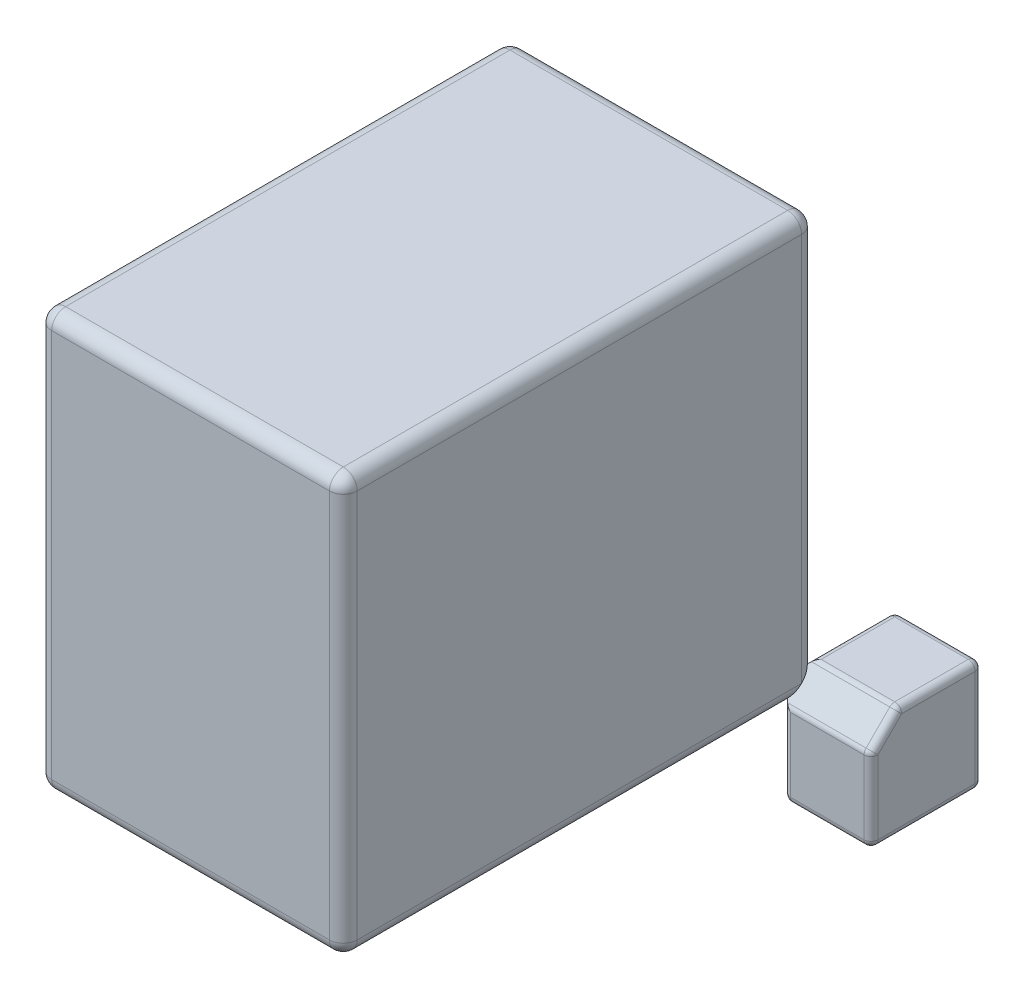
from build123d import *

# Parameters (mm, degrees)
SKETCH1_W                = 22
SKETCH1_H                = 30
BOSS_EXTRUDE1_DEPTH      = 34
SHELL1_T                 = 1
BOSS_EXTRUDE3_DEPTH      = 6
BOSS_EXTRUDE3_DEPTH_BACK = 2
SKETCH2_W                = 8
SKETCH2_H                = 8
CHAMFER2_SIZE            = 2
FILLET1_R                = 1
FILLET2_R                = 0.5


with BuildPart() as part:
    # Sketch1 → Boss-Extrude1 (new body)
    with BuildSketch(Plane.XY):
        with Locations((11, 15)):
            Rectangle(SKETCH1_W, SKETCH1_H)
    extrude(amount=BOSS_EXTRUDE1_DEPTH)

    # Shell1 (no face opened: a closed hollow body)
    add(offset(amount=-SHELL1_T, mode=Mode.PRIVATE), mode=Mode.SUBTRACT)

    # Sketch2 → Boss-Extrude3 (add, two sides: drawn at the far end of the back side and taken through both)
    with BuildSketch(Plane(origin=(0, 0, 0), x_dir=(-1, 0, 0), z_dir=(0, 0, -1)).offset(-BOSS_EXTRUDE3_DEPTH_BACK)):
        with Locations((-24, -2)):
            Rectangle(SKETCH2_W, SKETCH2_H)
    extrude(amount=BOSS_EXTRUDE3_DEPTH + BOSS_EXTRUDE3_DEPTH_BACK)

    # Chamfer2
    chamfer2_edges = [part.edges().sort_by_distance(p)[0] for p in [
        (20, -3, 2),
        (20, 2, -3),
        (25, 2, 2),
    ]]
    chamfer(chamfer2_edges, length=CHAMFER2_SIZE)

    # Fillet1
    # the kernel refuses this fillet: 1 mm, written as the material it takes off along each edge
    with BuildSketch(Plane(origin=(1, 29, 1), x_dir=(0, 1, 0), z_dir=(0, 0, -1))) as fillet1_piece_1_section:
        Polygon((0, 0), (FILLET1_R, 0), (FILLET1_R, -FILLET1_R), (0, -FILLET1_R), align=None)
    fillet1_piece_1 = extrude(amount=FILLET1_R, mode=Mode.PRIVATE)
    fillet1_piece_1 = fillet1_piece_1 - Plane(origin=(1, 29, 1), x_dir=(0.7071067811865475, -0.7071067811865475, 0), z_dir=(0, 0, -1)) * Sphere(FILLET1_R, mode=Mode.PRIVATE)
    add(fillet1_piece_1, mode=Mode.SUBTRACT)
    with BuildSketch(Plane(origin=(1, 1, 1), x_dir=(0, 0, -1), z_dir=(0, -1, 0))) as fillet1_piece_2_section:
        Polygon((0, 0), (FILLET1_R, 0), (FILLET1_R, -FILLET1_R), (0, -FILLET1_R), align=None)
    fillet1_piece_2 = extrude(amount=FILLET1_R, mode=Mode.PRIVATE)
    fillet1_piece_2 = fillet1_piece_2 - Plane(origin=(1, 1, 1), x_dir=(0.7071067811865475, 0, 0.7071067811865475), z_dir=(0, -1, 0)) * Sphere(FILLET1_R, mode=Mode.PRIVATE)
    add(fillet1_piece_2, mode=Mode.SUBTRACT)
    with BuildSketch(Plane(origin=(21, 29, 1), x_dir=(0, 0, -1), z_dir=(0, 1, 0))) as fillet1_piece_3_section:
        Polygon((0, 0), (FILLET1_R, 0), (FILLET1_R, -FILLET1_R), (0, -FILLET1_R), align=None)
    fillet1_piece_3 = extrude(amount=FILLET1_R, mode=Mode.PRIVATE)
    fillet1_piece_3 = fillet1_piece_3 - Plane(origin=(21, 29, 1), x_dir=(-0.7071067811865475, 0, 0.7071067811865475), z_dir=(0, 1, 0)) * Sphere(FILLET1_R, mode=Mode.PRIVATE)
    add(fillet1_piece_3, mode=Mode.SUBTRACT)
    with BuildSketch(Plane(origin=(1, 1, 33), x_dir=(-1, 0, 0), z_dir=(0, -1, 0))) as fillet1_piece_4_section:
        Polygon((0, 0), (FILLET1_R, 0), (FILLET1_R, -FILLET1_R), (0, -FILLET1_R), align=None)
    fillet1_piece_4 = extrude(amount=FILLET1_R, mode=Mode.PRIVATE)
    fillet1_piece_4 = fillet1_piece_4 - Plane(origin=(1, 1, 33), x_dir=(0.7071067811865475, 0, -0.7071067811865475), z_dir=(0, -1, 0)) * Sphere(FILLET1_R, mode=Mode.PRIVATE)
    add(fillet1_piece_4, mode=Mode.SUBTRACT)
    with BuildSketch(Plane(origin=(21, 1, 33), x_dir=(1, 0, 0), z_dir=(0, -1, 0))) as fillet1_piece_5_section:
        Polygon((0, 0), (FILLET1_R, 0), (FILLET1_R, FILLET1_R), (0, FILLET1_R), align=None)
    fillet1_piece_5 = extrude(amount=FILLET1_R, mode=Mode.PRIVATE)
    fillet1_piece_5 = fillet1_piece_5 - Plane(origin=(21, 1, 33), x_dir=(-0.7071067811865475, 0, -0.7071067811865475), z_dir=(0, -1, 0)) * Sphere(FILLET1_R, mode=Mode.PRIVATE)
    add(fillet1_piece_5, mode=Mode.SUBTRACT)
    with BuildSketch(Plane(origin=(21, 29, 33), x_dir=(1, 0, 0), z_dir=(0, 1, 0))) as fillet1_piece_6_section:
        Polygon((0, 0), (FILLET1_R, 0), (FILLET1_R, -FILLET1_R), (0, -FILLET1_R), align=None)
    fillet1_piece_6 = extrude(amount=FILLET1_R, mode=Mode.PRIVATE)
    fillet1_piece_6 = fillet1_piece_6 - Plane(origin=(21, 29, 33), x_dir=(-0.7071067811865475, 0, -0.7071067811865475), z_dir=(0, 1, 0)) * Sphere(FILLET1_R, mode=Mode.PRIVATE)
    add(fillet1_piece_6, mode=Mode.SUBTRACT)
    with BuildSketch(Plane(origin=(1, 29, 33), x_dir=(-1, 0, 0), z_dir=(0, 1, 0))) as fillet1_piece_7_section:
        Polygon((0, 0), (FILLET1_R, 0), (FILLET1_R, FILLET1_R), (0, FILLET1_R), align=None)
    fillet1_piece_7 = extrude(amount=FILLET1_R, mode=Mode.PRIVATE)
    fillet1_piece_7 = fillet1_piece_7 - Plane(origin=(1, 29, 33), x_dir=(0.7071067811865475, 0, -0.7071067811865475), z_dir=(0, 1, 0)) * Sphere(FILLET1_R, mode=Mode.PRIVATE)
    add(fillet1_piece_7, mode=Mode.SUBTRACT)
    with BuildSketch(Plane(origin=(0, 29, 0), x_dir=(1, 0, 0), z_dir=(0, -1, 0)), Plane(origin=(22, 1, 34), x_dir=(0, 0, -1), z_dir=(0, 1, 0)), Plane(origin=(0, 29, 34), x_dir=(0, 0, -1), z_dir=(0, -1, 0))) as fillet1_piece_8:
        with BuildLine():
            CenterArc((FILLET1_R, FILLET1_R), FILLET1_R, 180, 90)
            Line((0, FILLET1_R), (0, 0))
            Line((0, 0), (FILLET1_R, 0))
        make_face()
    extrude(amount=28, mode=Mode.SUBTRACT)
    with BuildSketch(Plane(origin=(1, 0, 0), x_dir=(0, 0, 1), z_dir=(1, 0, 0))) as fillet1_piece_9_section:
        with BuildLine():
            CenterArc((FILLET1_R, -FILLET1_R), FILLET1_R, 90, 90)
            Line((0, -FILLET1_R), (0, 0))
            Line((0, 0), (FILLET1_R, 0))
        make_face()
    fillet1_piece_9 = extrude(amount=21.5, mode=Mode.PRIVATE)
    fillet1_piece_9 = split(fillet1_piece_9, bisect_by=Plane(origin=(15.381840504, 0.226418621, -4.618159496), z_dir=(-0.7071067811865476, 0, 0.7071067811865476)), keep=Keep.TOP, mode=Mode.PRIVATE)
    fillet1_piece_9 = split(fillet1_piece_9, bisect_by=Plane(origin=(15.381840504, -4.618159496, 0.226418621), z_dir=(-0.7071067811865475, 0.7071067811865476, 0)), keep=Keep.TOP, mode=Mode.PRIVATE)
    add(fillet1_piece_9, mode=Mode.SUBTRACT)
    with BuildSketch(Plane(origin=(1, 0, 0), x_dir=(0, 0, 1), z_dir=(1, 0, 0))) as fillet1_piece_10_section:
        with BuildLine():
            CenterArc((FILLET1_R, -FILLET1_R), FILLET1_R, 90, 90)
            Line((0, -FILLET1_R), (0, 0))
            Line((0, 0), (FILLET1_R, 0))
        make_face()
    fillet1_piece_10 = extrude(amount=21.5, mode=Mode.PRIVATE)
    fillet1_piece_10 = split(fillet1_piece_10, bisect_by=Plane(origin=(20.16446835, 0.528927527, 0.16446835), z_dir=(0.7071067811865476, 0, -0.7071067811865476)), keep=Keep.TOP, mode=Mode.PRIVATE)
    fillet1_piece_10 = split(fillet1_piece_10, bisect_by=Plane(origin=(20.407441135, 0.407441135, 0.042981958), z_dir=(-0.7071067811865475, 0.7071067811865476, 0)), keep=Keep.TOP, mode=Mode.PRIVATE)
    add(fillet1_piece_10, mode=Mode.SUBTRACT)
    with BuildSketch(Plane(origin=(1, 0, 0), x_dir=(0, 0, 1), z_dir=(1, 0, 0))) as fillet1_piece_11_section:
        with BuildLine():
            CenterArc((FILLET1_R, -FILLET1_R), FILLET1_R, 90, 90)
            Line((0, -FILLET1_R), (0, 0))
            Line((0, 0), (FILLET1_R, 0))
        make_face()
    fillet1_piece_11 = extrude(amount=21.5, mode=Mode.PRIVATE)
    fillet1_piece_11 = split(fillet1_piece_11, bisect_by=Plane(origin=(20.407441135, 0.042981958, 0.407441135), z_dir=(-0.7071067811865476, 0, 0.7071067811865476)), keep=Keep.TOP, mode=Mode.PRIVATE)
    fillet1_piece_11 = split(fillet1_piece_11, bisect_by=Plane(origin=(20.16446835, 0.16446835, 0.528927527), z_dir=(0.7071067811865475, -0.7071067811865476, 0)), keep=Keep.TOP, mode=Mode.PRIVATE)
    add(fillet1_piece_11, mode=Mode.SUBTRACT)
    with BuildSketch(Plane(origin=(22, -0.5, 0), x_dir=(-1, 0, 0), z_dir=(0, 1, 0))) as fillet1_piece_12_section:
        with BuildLine():
            CenterArc((FILLET1_R, FILLET1_R), FILLET1_R, 180, 90)
            Line((0, FILLET1_R), (0, 0))
            Line((0, 0), (FILLET1_R, 0))
        make_face()
    fillet1_piece_12 = extrude(amount=29.5, mode=Mode.PRIVATE)
    fillet1_piece_12 = split(fillet1_piece_12, bisect_by=Plane(origin=(21.83553165, 1.83553165, 0.528927527), z_dir=(0.7071067811865475, -0.7071067811865476, 0)), keep=Keep.TOP, mode=Mode.PRIVATE)
    fillet1_piece_12 = split(fillet1_piece_12, bisect_by=Plane(origin=(21.957018042, 1.592558865, 0.407441135), z_dir=(0, 0.7071067811865476, 0.7071067811865476)), keep=Keep.TOP, mode=Mode.PRIVATE)
    add(fillet1_piece_12, mode=Mode.SUBTRACT)
    with BuildSketch(Plane(origin=(22, -0.5, 0), x_dir=(-1, 0, 0), z_dir=(0, 1, 0))) as fillet1_piece_13_section:
        with BuildLine():
            CenterArc((FILLET1_R, FILLET1_R), FILLET1_R, 180, 90)
            Line((0, FILLET1_R), (0, 0))
            Line((0, 0), (FILLET1_R, 0))
        make_face()
    fillet1_piece_13 = extrude(amount=29.5, mode=Mode.PRIVATE)
    fillet1_piece_13 = split(fillet1_piece_13, bisect_by=Plane(origin=(21.592558865, 1.592558865, 0.042981958), z_dir=(-0.7071067811865475, 0.7071067811865476, 0)), keep=Keep.TOP, mode=Mode.PRIVATE)
    fillet1_piece_13 = split(fillet1_piece_13, bisect_by=Plane(origin=(21.471072473, 1.83553165, 0.16446835), z_dir=(0, -0.7071067811865476, -0.7071067811865476)), keep=Keep.TOP, mode=Mode.PRIVATE)
    add(fillet1_piece_13, mode=Mode.SUBTRACT)
    with BuildSketch(Plane(origin=(22, -0.5, 0), x_dir=(-1, 0, 0), z_dir=(0, 1, 0))) as fillet1_piece_14_section:
        with BuildLine():
            CenterArc((FILLET1_R, FILLET1_R), FILLET1_R, 180, 90)
            Line((0, FILLET1_R), (0, 0))
            Line((0, 0), (FILLET1_R, 0))
        make_face()
    fillet1_piece_14 = extrude(amount=29.5, mode=Mode.PRIVATE)
    fillet1_piece_14 = split(fillet1_piece_14, bisect_by=Plane(origin=(28.618183131, 8.618183131, 0.226411675), z_dir=(-0.7071067811865475, 0.7071067811865476, 0)), keep=Keep.TOP, mode=Mode.PRIVATE)
    fillet1_piece_14 = split(fillet1_piece_14, bisect_by=Plane(origin=(21.773588325, 8.618183131, -6.618183131), z_dir=(0, 0.7071067811865476, 0.7071067811865476)), keep=Keep.TOP, mode=Mode.PRIVATE)
    add(fillet1_piece_14, mode=Mode.SUBTRACT)
    with BuildSketch(Plane(origin=(21, 30, 0), x_dir=(0, -1, 0), z_dir=(-1, 0, 0)), Plane(origin=(1, 0, 34), x_dir=(0, 0, -1), z_dir=(1, 0, 0))) as fillet1_piece_15:
        with BuildLine():
            CenterArc((FILLET1_R, FILLET1_R), FILLET1_R, 180, 90)
            Line((0, FILLET1_R), (0, 0))
            Line((0, 0), (FILLET1_R, 0))
        make_face()
    extrude(amount=20, mode=Mode.SUBTRACT)
    with BuildSketch(Plane(origin=(21, 30, 34), x_dir=(0, -1, 0), z_dir=(-1, 0, 0))) as fillet1_piece_16:
        with BuildLine():
            CenterArc((FILLET1_R, -FILLET1_R), FILLET1_R, 90, 90)
            Line((0, -FILLET1_R), (0, 0))
            Line((0, 0), (FILLET1_R, 0))
        make_face()
    extrude(amount=20, mode=Mode.SUBTRACT)
    with BuildSketch(Plane(origin=(0, 30, 1), x_dir=(0, -1, 0), z_dir=(0, 0, 1)), Plane(origin=(0, 0, 1), x_dir=(1, 0, 0), z_dir=(0, 0, 1))) as fillet1_piece_17:
        with BuildLine():
            CenterArc((FILLET1_R, FILLET1_R), FILLET1_R, 180, 90)
            Line((0, FILLET1_R), (0, 0))
            Line((0, 0), (FILLET1_R, 0))
        make_face()
    extrude(amount=32, mode=Mode.SUBTRACT)
    with BuildSketch(Plane(origin=(22, 30, 1), x_dir=(0, -1, 0), z_dir=(0, 0, 1))) as fillet1_piece_18:
        with BuildLine():
            CenterArc((FILLET1_R, -FILLET1_R), FILLET1_R, 90, 90)
            Line((0, -FILLET1_R), (0, 0))
            Line((0, 0), (FILLET1_R, 0))
        make_face()
    extrude(amount=32, mode=Mode.SUBTRACT)
    with BuildSketch(Plane(origin=(22, 0, -0.5), x_dir=(-1, 0, 0), z_dir=(0, 0, 1))) as fillet1_piece_19_section:
        with BuildLine():
            CenterArc((FILLET1_R, -FILLET1_R), FILLET1_R, 90, 90)
            Line((0, -FILLET1_R), (0, 0))
            Line((0, 0), (FILLET1_R, 0))
        make_face()
    fillet1_piece_19 = extrude(amount=33.5, mode=Mode.PRIVATE)
    fillet1_piece_19 = split(fillet1_piece_19, bisect_by=Plane(origin=(21.83553165, 0.528927527, 1.83553165), z_dir=(0.7071067811865476, 0, -0.7071067811865476)), keep=Keep.TOP, mode=Mode.PRIVATE)
    fillet1_piece_19 = split(fillet1_piece_19, bisect_by=Plane(origin=(21.957018042, 0.407441135, 1.592558865), z_dir=(0, 0.7071067811865476, 0.7071067811865476)), keep=Keep.TOP, mode=Mode.PRIVATE)
    add(fillet1_piece_19, mode=Mode.SUBTRACT)
    with BuildSketch(Plane(origin=(22, 0, -0.5), x_dir=(-1, 0, 0), z_dir=(0, 0, 1))) as fillet1_piece_20_section:
        with BuildLine():
            CenterArc((FILLET1_R, -FILLET1_R), FILLET1_R, 90, 90)
            Line((0, -FILLET1_R), (0, 0))
            Line((0, 0), (FILLET1_R, 0))
        make_face()
    fillet1_piece_20 = extrude(amount=33.5, mode=Mode.PRIVATE)
    fillet1_piece_20 = split(fillet1_piece_20, bisect_by=Plane(origin=(21.592558865, 0.042981958, 1.592558865), z_dir=(-0.7071067811865476, 0, 0.7071067811865476)), keep=Keep.TOP, mode=Mode.PRIVATE)
    fillet1_piece_20 = split(fillet1_piece_20, bisect_by=Plane(origin=(21.471072473, 0.16446835, 1.83553165), z_dir=(0, -0.7071067811865476, -0.7071067811865476)), keep=Keep.TOP, mode=Mode.PRIVATE)
    add(fillet1_piece_20, mode=Mode.SUBTRACT)
    with BuildSketch(Plane(origin=(22, 0, -0.5), x_dir=(-1, 0, 0), z_dir=(0, 0, 1))) as fillet1_piece_21_section:
        with BuildLine():
            CenterArc((FILLET1_R, -FILLET1_R), FILLET1_R, 90, 90)
            Line((0, -FILLET1_R), (0, 0))
            Line((0, 0), (FILLET1_R, 0))
        make_face()
    fillet1_piece_21 = extrude(amount=33.5, mode=Mode.PRIVATE)
    fillet1_piece_21 = split(fillet1_piece_21, bisect_by=Plane(origin=(29.618190384, 0.226409543, 9.618190384), z_dir=(-0.7071067811865476, 0, 0.7071067811865476)), keep=Keep.TOP, mode=Mode.PRIVATE)
    fillet1_piece_21 = split(fillet1_piece_21, bisect_by=Plane(origin=(21.773590457, -7.618190384, 9.618190384), z_dir=(0, 0.7071067811865476, 0.7071067811865476)), keep=Keep.TOP, mode=Mode.PRIVATE)
    add(fillet1_piece_21, mode=Mode.SUBTRACT)

    # Fillet2
    fillet2_edges = [part.edges().sort_by_distance(p)[0] for p in [
        (24, -6, -6),
        (28, -6, -2),
        (28, -2, -6),
        (28, 2, -3),
        (25, 2, -6),
        (22, 2, -3),
        (25, 2, 0),
        (28, -3, 2),
        (28, 1, 1),
        (25, -6, 2),
        (22, -3, 2),
        (25, 0, 2),
        (20, -3, -6),
        (20, -6, -3),
        (20, -3, 0),
        (20, 0, -3),
        (21, 1, -6),
        (21, -6, 1),
    ]]
    fillet(fillet2_edges, radius=FILLET2_R)


solid = part.part
